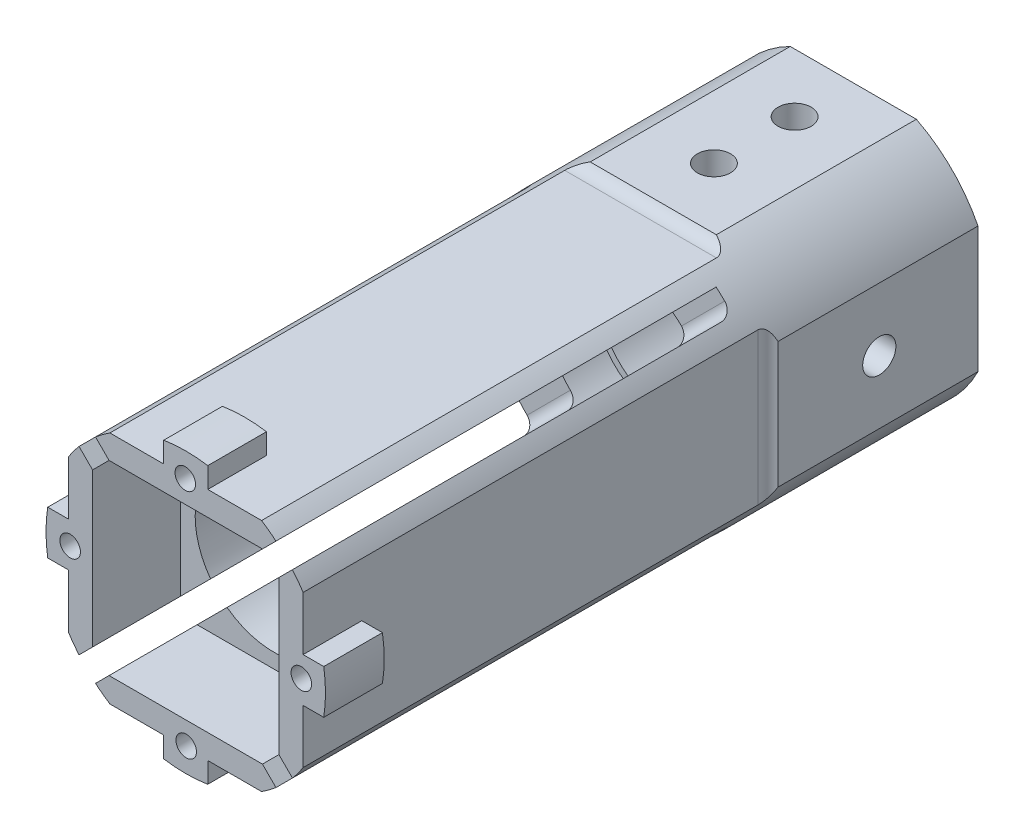
from build123d import *

# Parameters (mm, degrees)
SKETCH1_R           = 9.525
SKETCH1_R_2         = 4.25
BOSS_EXTRUDE1_DEPTH = 45.5
SKETCH2_R           = 4.9022
CUT_EXTRUDE1_DEPTH  = 12.5
SKETCH3_R           = 14.693864286
SKETCH3_W           = 16
SKETCH3_H           = 16
CUT_EXTRUDE2_DEPTH  = 40
SKETCH14_W          = 12.7
SKETCH14_H          = 12.7
CUT_EXTRUDE10_DEPTH = 6
CUT_EXTRUDE8_DEPTH  = 30
FILLET6_R           = 0.79375
FILLET4_R           = 1
SKETCH15_R          = 1.1303
CUT_EXTRUDE11_DEPTH = 50
SKETCH17_R          = 1.1303
CUT_EXTRUDE13_DEPTH = 60
SKETCH18_W          = 30.385302108
SKETCH18_H          = 28.40257804
SKETCH18_W_2        = 17
SKETCH18_H_2        = 17
CUT_EXTRUDE14_DEPTH = 60
CIRPATTERN2_START   = 0.79375
CIRPATTERN2_DEPTH   = 8.73125
CIRPATTERN2_START_2 = -9.52500012
CIRPATTERN2_2_DEPTH = 19.05000012
SKETCH19_R          = 5.3578125
CUT_EXTRUDE15_DEPTH = 50
BOSS_EXTRUDE2_START = -4
BOSS_EXTRUDE2_DEPTH = 4
SKETCH21_R          = 0.7
CUT_EXTRUDE17_DEPTH = 3.175
CIRPATTERN3_COUNT   = 4


with BuildPart() as part:
    # Sketch1 → Boss-Extrude1 (new body)
    with BuildSketch(Plane.XY):
        Circle(SKETCH1_R)
        Circle(SKETCH1_R_2, mode=Mode.SUBTRACT)
    extrude(amount=BOSS_EXTRUDE1_DEPTH)

    # Sketch2 → Cut-Extrude1 (cut)
    with BuildSketch(Plane(origin=(0, 0, 0), x_dir=(-1, 0, 0), z_dir=(0, 0, -1))):
        Circle(SKETCH2_R)
    extrude(amount=-CUT_EXTRUDE1_DEPTH, mode=Mode.SUBTRACT)

    # Sketch3 → Cut-Extrude2 (cut)
    with BuildSketch(Plane(origin=(0, 0, 13.5), x_dir=(-1, 0, 0), z_dir=(0, 0, -1))):
        Circle(SKETCH3_R)
        Rectangle(SKETCH3_W, SKETCH3_H, mode=Mode.SUBTRACT)
    extrude(amount=-CUT_EXTRUDE2_DEPTH, mode=Mode.SUBTRACT)

    # Sketch14 → Cut-Extrude10 (cut)
    with BuildSketch(Plane.XY.offset(45.5)):
        Rectangle(SKETCH14_W, SKETCH14_H)
    extrude(amount=-CUT_EXTRUDE10_DEPTH, mode=Mode.SUBTRACT)

    # Sketch11 → Cut-Extrude8 (cut)
    with BuildSketch(Plane.XY.offset(45.5)):
        with BuildLine():
            Line((-0.561266008, -0.561266008), (-7.411347572, 6.288815557))
            ThreePointArc((-7.411347572, 6.288815557), (-7.411347572, 7.411347572), (-6.288815557, 7.411347572))
            Line((-6.288815557, 7.411347572), (0.561266008, 0.561266008))
            ThreePointArc((0.561266008, 0.561266008), (0.561266008, -0.561266008), (-0.561266008, -0.561266008))
        make_face()
    extrude(amount=-CUT_EXTRUDE8_DEPTH, mode=Mode.SUBTRACT)

    # Fillet6
    fillet6_edges = [part.edges().sort_by_distance(p)[0] for p in [
        (-4.270779765, 5.39331178, 15.5),
        (-5.39331178, 4.270779765, 15.5),
    ]]
    fillet(fillet6_edges, radius=FILLET6_R - 0.0001)  # a hair under: the kernel refuses the full size

    # Fillet4
    fillet4_edges = [part.edges().sort_by_distance(p)[0] for p in [
        (-8, 0, 13.5),
        (0, -8, 13.5),
        (8, 0, 13.5),
        (0, 8, 13.5),
    ]]
    fillet(fillet4_edges, radius=FILLET4_R)

    # Sketch15 → Cut-Extrude11 (cut)
    with BuildSketch(Plane(origin=(9.525, 0, 0), x_dir=(0, 0, -1), z_dir=(1, 0, 0))):
        with Locations((-6.727901899, 0)):
            Circle(SKETCH15_R)
    extrude(amount=-CUT_EXTRUDE11_DEPTH, mode=Mode.SUBTRACT)

    # Sketch17 → Cut-Extrude13 (cut)
    with BuildSketch(Plane(origin=(0, -9.525, 0), x_dir=(-1, 0, 0), z_dir=(0, -1, 0))):
        with Locations(Location((0, -4, 0), (0, 0, 90))):
            Circle(SKETCH17_R)
        with Locations(Location((0, -9.5, 0), (0, 0, 90))):
            Circle(SKETCH17_R)
    extrude(amount=-CUT_EXTRUDE13_DEPTH, mode=Mode.SUBTRACT)

    # Sketch18 → Cut-Extrude14 (cut)
    with BuildSketch(Plane(origin=(0, 0, 0), x_dir=(-1, 0, 0), z_dir=(0, 0, -1))):
        Rectangle(SKETCH18_W, SKETCH18_H)
        Rectangle(SKETCH18_W_2, SKETCH18_H_2, mode=Mode.SUBTRACT)
    extrude(amount=-CUT_EXTRUDE14_DEPTH, mode=Mode.SUBTRACT)

    # CirPattern2: read off the stored shape, not the designer's step
    # CirPattern2 outline → CirPattern2 (cut)
    with BuildSketch(Plane(origin=(0, 0, 0), x_dir=(0.7071067811865471, 0.707106781186548, 0), z_dir=(0.707106781186548, -0.707106781186547, 0)).offset(CIRPATTERN2_START)):
        with BuildLine():
            Line((0.79375, 45.5), (-0.79375, 45.5))
            Line((-0.79375, 45.5), (-0.79375, 16.29375))
            ThreePointArc((-0.79375, 16.29375), (-0.561266008, 15.732483992), (0, 15.5))
            ThreePointArc((0, 15.5), (0.561266008, 15.732483992), (0.79375, 16.29375))
            Line((0.79375, 16.29375), (0.79375, 45.5))
        make_face()
    extrude(amount=CIRPATTERN2_DEPTH, mode=Mode.SUBTRACT)

    # CirPattern2 2 outline → CirPattern2 2 (cut)
    with BuildSketch(Plane(origin=(0, 0, 0), x_dir=(0.7071067811865551, -0.70710678118654, 0), z_dir=(0.70710678118654, 0.707106781186555, 0)).offset(CIRPATTERN2_START_2)):
        with BuildLine():
            Line((0, -15.5), (-0.79375, -15.5))
            Line((-0.79375, -15.5), (-0.79375, -45.5))
            Line((-0.79375, -45.5), (0.79375, -45.5))
            Line((0.79375, -45.5), (0.79375, -16.29375))
            ThreePointArc((0.79375, -16.29375), (0.561266008, -15.732483992), (0, -15.5))
        make_face()
    extrude(amount=CIRPATTERN2_2_DEPTH, mode=Mode.SUBTRACT)

    # Sketch19 → Cut-Extrude15 (cut)
    with BuildSketch(Plane(origin=(0, 0, 12.5), x_dir=(-1, 0, 0), z_dir=(0, 0, -1))):
        Circle(SKETCH19_R)
    extrude(amount=-CUT_EXTRUDE15_DEPTH, mode=Mode.SUBTRACT)

    # Sketch20 → Boss-Extrude2 (add)
    with BuildSketch(Plane.XY.offset(45.5).offset(BOSS_EXTRUDE2_START)):
        with BuildLine():
            Line((9.406148255, 1.5), (8, 1.5))
            Line((8, 1.5), (8, -1.5))
            Line((8, -1.5), (9.406148255, -1.5))
            ThreePointArc((9.406148255, -1.5), (9.495240574, -0.752350606), (9.525, 0))
            ThreePointArc((9.525, 0), (9.495240574, 0.752350606), (9.406148255, 1.5))
        make_face()
        with BuildLine():
            Line((-8, -1.5), (-8, 1.5))
            Line((-8, 1.5), (-9.406148255, 1.5))
            ThreePointArc((-9.406148255, 1.5), (-9.525, 0), (-9.406148255, -1.5))
            Line((-9.406148255, -1.5), (-8, -1.5))
        make_face()
        with BuildLine():
            Line((1.5, -9.406148255), (1.5, -8))
            Line((1.5, -8), (-1.5, -8))
            Line((-1.5, -8), (-1.5, -9.406148255))
            ThreePointArc((-1.5, -9.406148255), (0, -9.525), (1.5, -9.406148255))
        make_face()
        with BuildLine():
            Line((-1.5, 8), (1.5, 8))
            Line((1.5, 8), (1.5, 9.406148255))
            ThreePointArc((1.5, 9.406148255), (0, 9.525), (-1.5, 9.406148255))
            Line((-1.5, 9.406148255), (-1.5, 8))
        make_face()
    extrude(amount=BOSS_EXTRUDE2_DEPTH)

    # Sketch21 → Cut-Extrude17 (cut)
    with BuildSketch(Plane.XY.offset(45.5)):
        with Locations((-0.031208627, 7.878074128)):
            Circle(SKETCH21_R)
    cut_extrude17 = extrude(amount=-CUT_EXTRUDE17_DEPTH, mode=Mode.SUBTRACT)

    # CirPattern3: Cut-Extrude17 ×4 about axis
    cirpattern3_axis = Axis((0, 0, 0), (0, 0, 1))
    for i in range(1, CIRPATTERN3_COUNT):
        add(cut_extrude17.rotate(cirpattern3_axis, i * 360 / CIRPATTERN3_COUNT), mode=Mode.SUBTRACT)


solid = part.part
